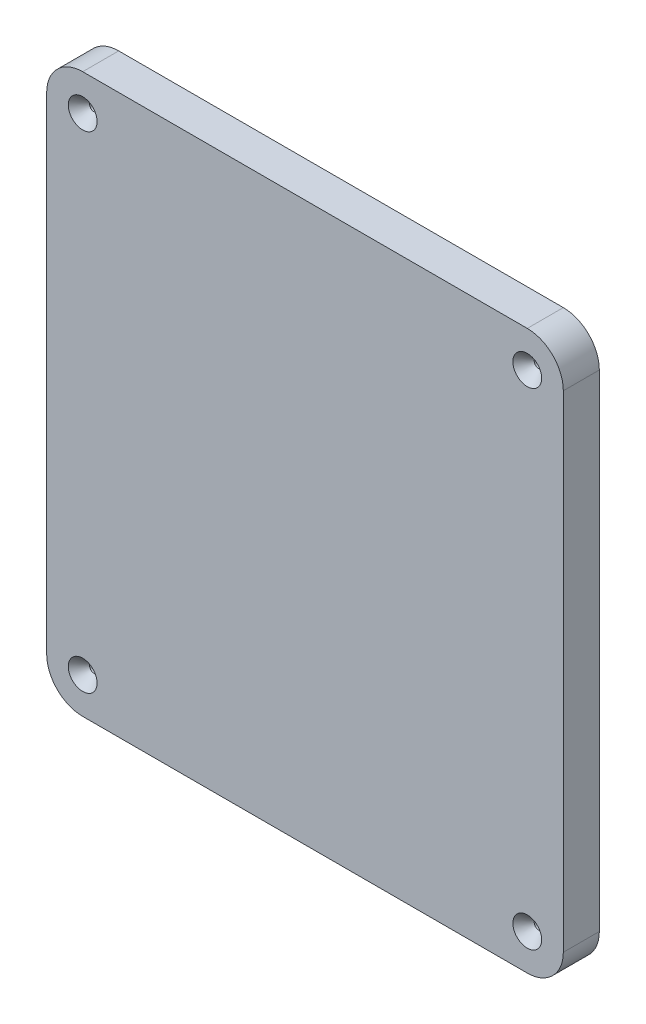
from build123d import *

# Parameters (mm, degrees)
SKETCH1_W           = 182.149999994
SKETCH1_H           = 196.85
BOSS_EXTRUDE1_DEPTH = 12.7
FILLET1_R           = 12.7
HOLE1_D             = 3.175
HOLE1_DEPTH         = 31.75
HOLE1_CSINK_D       = 10.16
HOLE1_CSINK_ANGLE   = 82
HOLE1_TIP           = 0.953866233


with BuildPart() as part:
    # Sketch1 → Boss-Extrude1 (new body)
    with BuildSketch(Plane.XY):
        with Locations((47.975000003, 766.50216301)):
            Rectangle(SKETCH1_W, SKETCH1_H)
    extrude(amount=BOSS_EXTRUDE1_DEPTH)

    # Fillet1
    fillet1_edges = [part.edges().sort_by_distance(p)[0] for p in [
        (139.05, 864.92716301, 6.35),
        (139.05, 668.07716301, 6.35),
        (-43.099999994, 668.07716301, 6.35),
        (-43.099999994, 864.92716301, 6.35),
    ]]
    fillet(fillet1_edges, radius=FILLET1_R)

    # Hole1
    with Locations(Plane(origin=(47.975000003, -440.812032837, 12.7), x_dir=(1, 0, 0), z_dir=(0, 0, 1))):
        with Locations((-78.374999997, 1293.039195846), (-78.374999997, 1121.589195846), (78.374999997, 1121.589195846), (78.374999997, 1293.039195846), (-764.015524801, 1530.078195669)):
            CounterSinkHole(HOLE1_D / 2, HOLE1_CSINK_D / 2, depth=HOLE1_DEPTH, counter_sink_angle=HOLE1_CSINK_ANGLE)
            with Locations((0, 0, -(HOLE1_DEPTH + HOLE1_TIP / 2))):  # 118° drill point
                Cone(0, HOLE1_D / 2, HOLE1_TIP, mode=Mode.SUBTRACT)


solid = part.part
